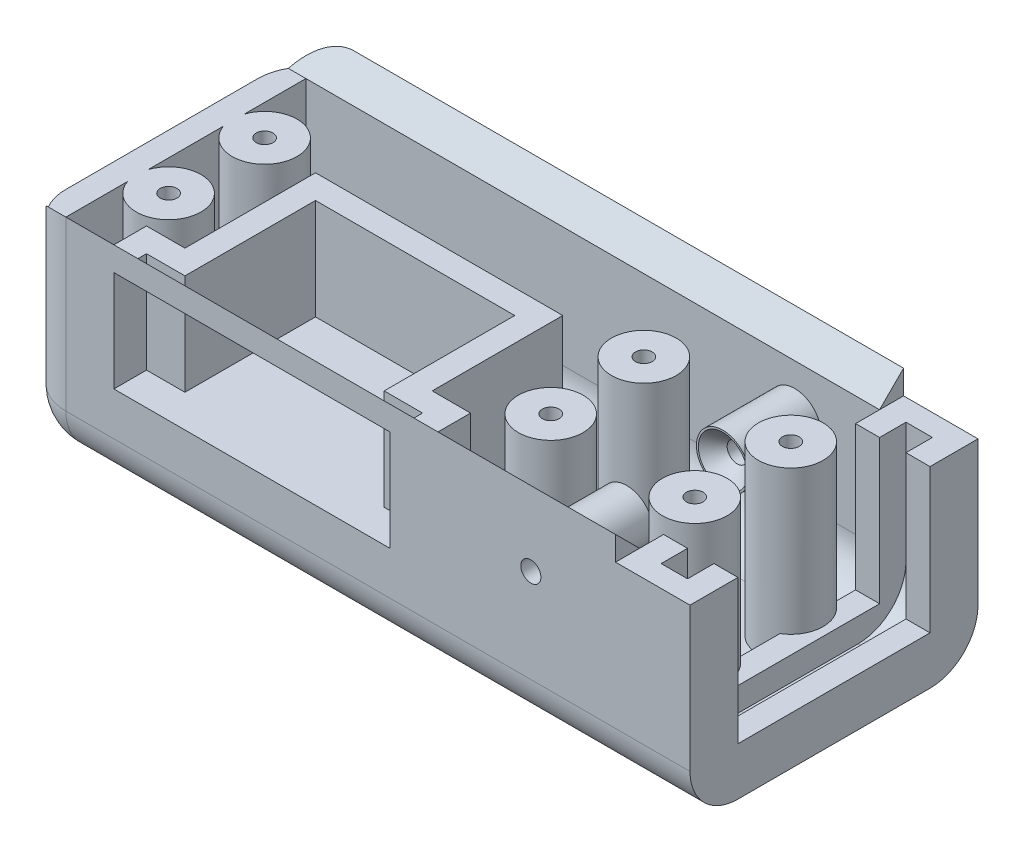
from build123d import *

# Parameters (mm, degrees)
BOSS_EXTRUDE1_DEPTH = 35
SKETCH2_W           = 140
SKETCH2_H           = 60
BOSS_EXTRUDE2_DEPTH = 5
SKETCH3_W           = 5
SKETCH3_H           = 40
BOSS_EXTRUDE3_DEPTH = 5
FILLET1_R           = 10
BOSS_EXTRUDE4_DEPTH = 124.5
BOSS_EXTRUDE5_DEPTH = 14
FILLET2_R           = 10
M5_TAPPED_HOLE1_D   = 4.2
SKETCH6_R           = 6.75
SKETCH6_R_2         = 1.75
BOSS_EXTRUDE6_DEPTH = 35
BOSS_EXTRUDE7_START = 15
SKETCH12_R          = 5.5
SKETCH12_R_2        = 2.1
BOSS_EXTRUDE7_DEPTH = 15
CHAMFER2_SIZE       = 3
CUT_EXTRUDE1_START  = -15
SKETCH14_R          = 1.75
CUT_EXTRUDE1_DEPTH  = 15
FILLET3_R           = 10


with BuildPart() as part:
    # Sketch1 → Boss-Extrude1 (new body)
    with BuildSketch(Plane(origin=(0, 0, 0), x_dir=(1, 0, 0), z_dir=(0, 1, 0))):
        Polygon((0, 0), (20, 0), (20, 6.8), (28, 6.8), (28, 34), (69.5, 34), (69.5, 6.8), (77.5, 6.8), (77.5, 0), (140, 0), (140, 10), (135, 10), (135, 4.5), (129.5, 4.5), (129.5, 10), (124.5, 10), (124.5, 5), (82.5, 5), (82.5, 11.8), (74.5, 11.8), (74.5, 39), (23, 39), (23, 11.8), (15, 11.8), (15, 5), (5, 5), (5, 55), (124.5, 55), (124.5, 50), (129.5, 50), (129.5, 55.5), (135, 55.5), (135, 50), (140, 50), (140, 60), (0, 60), align=None)
    extrude(amount=BOSS_EXTRUDE1_DEPTH)

    # Sketch2 → Boss-Extrude2 (add)
    with BuildSketch(Plane(origin=(0, 0, 0), x_dir=(-1, 0, 0), z_dir=(0, -1, 0))):
        with Locations((-70, 30)):
            Rectangle(SKETCH2_W, SKETCH2_H)
    extrude(amount=BOSS_EXTRUDE2_DEPTH)

    # Sketch3 → Boss-Extrude3 (add)
    with BuildSketch(Plane(origin=(0, 0, 0), x_dir=(1, 0, 0), z_dir=(0, 1, 0))):
        with Locations((127, 30)):
            Rectangle(SKETCH3_W, SKETCH3_H)
        with Locations((137.5, 30)):
            Rectangle(SKETCH3_W, SKETCH3_H)
    extrude(amount=BOSS_EXTRUDE3_DEPTH)

    # Fillet1
    fillet1_edges = [part.edges().sort_by_distance(p)[0] for p in [
        (10, 0, -5),
        (103.5, 0, -5),
        (132.25, 0, -4.5),
        (132.25, 0, -55.5),
        (64.75, 0, -55),
        (70, -5, -60),
    ]]
    fillet(fillet1_edges, radius=FILLET1_R)

    # Sketch4 → Boss-Extrude4 (add)
    with BuildSketch(Plane.ZY):
        Polygon((0, 35), (0, 40), (-5, 35), align=None)
        Polygon((-55, 35), (-60, 35), (-60, 40), align=None)
    extrude(amount=-BOSS_EXTRUDE4_DEPTH)

    # Sketch5 → Boss-Extrude5 (add)
    with BuildSketch(Plane(origin=(0, 0, 0), x_dir=(1, 0, 0), z_dir=(0, 1, 0))):
        Polygon((28, 34), (69.5, 34), (69.5, 6.8), (77.5, 6.8), (77.5, 0), (20, 0), (20, 6.8), (28, 6.8), align=None)
    extrude(amount=BOSS_EXTRUDE5_DEPTH)

    # Fillet2
    fillet2_edges = [part.edges().sort_by_distance(p)[0] for p in [
        (70, -5, 0),
    ]]
    fillet(fillet2_edges, radius=FILLET2_R)

    # M5 Tapped Hole1 (through all)
    with Locations(Plane.XY):
        with Locations((106.85, 24.5)):
            Hole(M5_TAPPED_HOLE1_D / 2)

    # Sketch6 → Boss-Extrude6 (add)
    with BuildSketch(Plane(origin=(0, 0, 0), x_dir=(1, 0, 0), z_dir=(0, 1, 0))):
        with Locations((11.396562082, 20)):
            Circle(SKETCH6_R)
        with Locations(Location((11.396562082, 20, 0), (0, 0, 270))):
            Circle(SKETCH6_R_2, mode=Mode.SUBTRACT)
    boss_extrude6 = extrude(amount=BOSS_EXTRUDE6_DEPTH)

    # Sketch-Pattern1: Boss-Extrude6 at 5 more places
    with Locations((0, 0, -20), (109.603438, 0, -20), (109.603438, 0, 0), (79.603438, 0, 0), (78.995708, 0, -20)):
        add(boss_extrude6)

    # Sketch12 → Boss-Extrude7 (add)
    with BuildSketch(Plane(origin=(0, 0, -5), x_dir=(-1, 0, 0), z_dir=(0, 0, -1)).offset(BOSS_EXTRUDE7_START)):
        with Locations(Location((-106.85, 24.5, 0), (0, 0, 180))):
            Circle(SKETCH12_R)
        with Locations(Location((-106.85, 24.5, 0), (0, 0, 180))):
            Circle(SKETCH12_R_2, mode=Mode.SUBTRACT)
    boss_extrude7 = extrude(amount=-BOSS_EXTRUDE7_DEPTH)

    # Mirror1: Boss-Extrude7 across plane
    add(boss_extrude7.mirror(Plane.XY.offset(-30)))

    # Chamfer2
    chamfer2_edges = [part.edges().sort_by_distance(p)[0] for p in [
        (104.75, 24.5, -20),
        (104.75, 24.5, -40),
    ]]
    chamfer(chamfer2_edges, length=CHAMFER2_SIZE)

    # Sketch14 → Cut-Extrude1 (cut)
    with BuildSketch(Plane(origin=(0, 0, 0), x_dir=(1, 0, 0), z_dir=(0, 1, 0)).offset(CUT_EXTRUDE1_START)):
        with Locations(Location((11.396562082, 20, 0), (0, 0, 90))):
            Circle(SKETCH14_R)
    cut_extrude1 = extrude(amount=CUT_EXTRUDE1_DEPTH, mode=Mode.SUBTRACT)

    # Sketch-Pattern2: Cut-Extrude1 at 5 more places
    with Locations((0, 0, -20), (109.603438, 0, -20), (109.603438, 0, 0), (79.603438, 0, 0), (78.995708, 0, -20)):
        add(cut_extrude1, mode=Mode.SUBTRACT)

    # Fillet3
    # the kernel refuses this fillet: 10 mm, written as the material it takes off along each edge
    with BuildSketch(Plane(origin=(0, 65, -60), x_dir=(0, 0, 1), z_dir=(0, -1, 0)), Plane(origin=(0, 65, 0), x_dir=(1, 0, 0), z_dir=(0, -1, 0))) as fillet3_piece_1:
        with BuildLine():
            CenterArc((FILLET3_R, -FILLET3_R), FILLET3_R, 90, 90)
            Line((0, -FILLET3_R), (0, 0))
            Line((0, 0), (FILLET3_R, 0))
        make_face()
    extrude(amount=60, mode=Mode.SUBTRACT)
    with BuildSketch(Plane(origin=(0, 5, -50), x_dir=(0, -1, 0), z_dir=(0, 0, 1))) as fillet3_piece_2:
        with BuildLine():
            CenterArc((10 - FILLET3_R, FILLET3_R), FILLET3_R, 270, 90)
            Line((10, FILLET3_R), (10, 0))
            Line((10, 0), (10 - FILLET3_R, 0))
        make_face()
    revolve(axis=Axis((0, 5, -50), (1, 0, 0)), revolution_arc=90, mode=Mode.SUBTRACT)
    with BuildSketch(Plane(origin=(0, -5, -50), x_dir=(0, 1, 0), z_dir=(0, 0, 1))) as fillet3_piece_3:
        with BuildLine():
            CenterArc((FILLET3_R, -FILLET3_R), FILLET3_R, 90, 90)
            Line((0, -FILLET3_R), (0, 0))
            Line((0, 0), (FILLET3_R, 0))
        make_face()
    extrude(amount=40, mode=Mode.SUBTRACT)
    with BuildSketch(Plane(origin=(0, 5, -10), x_dir=(0, -1, 0), z_dir=(0, 0, -1))) as fillet3_piece_4:
        with BuildLine():
            CenterArc((10 - FILLET3_R, -FILLET3_R), FILLET3_R, 0, 90)
            Line((10, -FILLET3_R), (10, 0))
            Line((10, 0), (10 - FILLET3_R, 0))
        make_face()
    revolve(axis=Axis((0, 5, -10), (-1, 0, 0)), revolution_arc=90, mode=Mode.SUBTRACT)


solid = part.part
